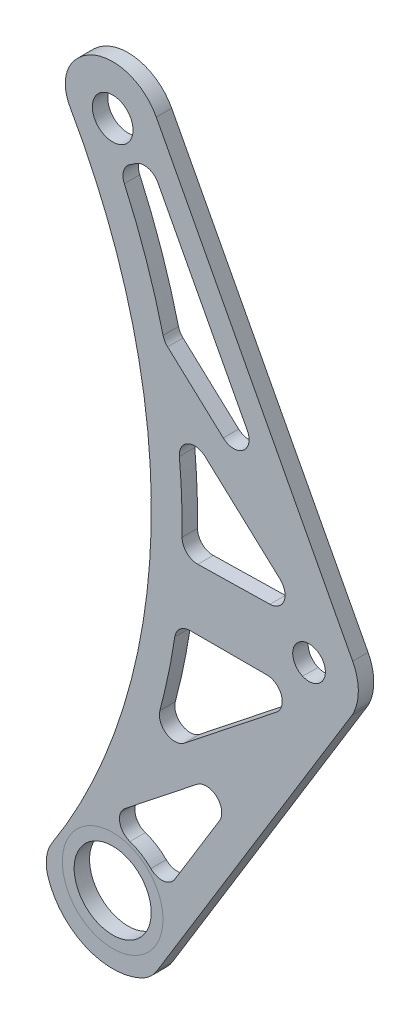
from build123d import *

# Parameters (mm, degrees)
SKETCH1_R           = 7.9375
SKETCH1_R_2         = 3.3655
SKETCH1_R_3         = 4.191
BOSS_EXTRUDE1_DEPTH = 3.175
CUT_EXTRUDE1_DEPTH  = 6.35
FILLET1_R           = 3.175
FILLET5_R           = 7.62


with BuildPart() as part:
    # Sketch1 → Boss-Extrude1 (new body)
    with BuildSketch(Plane.XY):
        with BuildLine():
            Line((8.990505701, 142.507164257), (49.453246099, 65.638340515))
            ThreePointArc((49.453246099, 65.638340515), (50.622740399, 60.905856258), (49.453246099, 56.173372001))
            Line((49.453246099, 56.173372001), (8.177790267, -11.326281223))
            ThreePointArc((8.177790267, -11.326281223), (-6.360706327, -12.437938536), (-13.97, 0))
            ThreePointArc((-13.97, 0), (7.91990549, 68.33468047), (-10.16, 137.77468))
            ThreePointArc((-10.16, 137.77468), (-2.437423033, 147.637974022), (8.990505701, 142.507164257))
        make_face()
        Circle(SKETCH1_R, mode=Mode.SUBTRACT)
        with Locations((40.462740399, 60.905856258)):
            Circle(SKETCH1_R_2, mode=Mode.SUBTRACT)
        with Locations((0, 137.77468)):
            Circle(SKETCH1_R_3, mode=Mode.SUBTRACT)
    extrude(amount=BOSS_EXTRUDE1_DEPTH)

    # Sketch2 → Cut-Extrude1 (cut)
    with BuildSketch(Plane.XY.offset(3.175)):
        with BuildLine():
            ThreePointArc((-0.124257687, 11.111805266), (6.119551738, 9.275707131), (10.264347662, 4.258030452))
            Line((10.264347662, 4.258030452), (31.313727824, 38.681050934))
            Line((31.313727824, 38.681050934), (1.961287607, 15.442397513))
            ThreePointArc((1.961287607, 15.442397513), (0.937773258, 13.267826895), (-0.124257687, 11.111805266))
        make_face()
        with BuildLine():
            Line((6.763206822, 27.343322009), (40.914079215, 54.38094756))
            ThreePointArc((40.914079215, 54.38094756), (40.688544415, 54.369255246), (40.462740399, 54.365356258))
            Line((40.462740399, 54.365356258), (13.177274796, 54.365356258))
            ThreePointArc((13.177274796, 54.365356258), (10.666365072, 40.689104041), (6.763206822, 27.343322009))
        make_face()
        with BuildLine():
            Line((14.227692925, 66.924652484), (40.332379532, 67.445056996))
            Line((40.332379532, 67.445056996), (12.691282428, 92.804736539))
            ThreePointArc((12.691282428, 92.804736539), (14.081637817, 79.901629399), (14.227692925, 66.924652484))
        make_face()
        with BuildLine():
            Line((10.611239694, 103.330724773), (36.257061309, 79.801636355))
            Line((36.257061309, 79.801636355), (6.979807085, 135.420906636))
            ThreePointArc((6.979807085, 135.420906636), (4.67858985, 132.085325641), (0.961351613, 130.471683418))
            ThreePointArc((0.961351613, 130.471683418), (6.511625183, 117.159092878), (10.611239694, 103.330724773))
        make_face()
    extrude(amount=-CUT_EXTRUDE1_DEPTH, mode=Mode.SUBTRACT)

    # Fillet1
    # the kernel refuses this fillet: 3.175 mm, written as the material it adds along each edge
    with BuildSketch(Plane(origin=(1.961287607, 15.442397513, 3.175), x_dir=(-0.42030668038784, -0.9073821104812206, 0), z_dir=(0, 0, -1))) as fillet1_piece_1:
        with BuildLine():
            CenterArc((0.755742265, -3.174987871), FILLET1_R, 90.158373023, 26.618624782)
            Line((-0.674656078, -0.340453415), (0, 0))
            ThreePointArc((0, 0), (0.373483081, -0.000516178), (0.746966162, 0))
        make_face()
    extrude(amount=3.175)
    with BuildSketch(Plane(origin=(-0.124257687, 11.111805266, 3.175), x_dir=(0.4359761911813302, 0.8999581994309626, 0), z_dir=(0, 0, -1))) as fillet1_piece_2:
        with BuildLine():
            CenterArc((4.22998716, 3.174619998), FILLET1_R, 172.83641486, 96.277116616)
            ThreePointArc((1.07977071, 3.570550945), (0.690776023, 1.739644609), (0, 0))
            ThreePointArc((0, 0), (2.090433086, 0.016171698), (4.180866173, 0))
        make_face()
    extrude(amount=3.175)
    with BuildSketch(Plane(origin=(10.264347662, 4.258030452, 3.175), x_dir=(0.5216861951219568, 0.853137453063207, 0), z_dir=(0, 0, -1))) as fillet1_piece_3:
        with BuildLine():
            CenterArc((4.899209013, -3.175), FILLET1_R, 90, 103.603922827)
            ThreePointArc((1.813283958, -3.921787493), (1.099083544, -1.871916155), (0, 0))
            Line((0, 0), (4.899209013, 0))
        make_face()
    extrude(amount=3.175)
    with BuildSketch(Plane(origin=(31.313727824, 38.681050934, 3.175), x_dir=(-0.7840288614357019, -0.6207243707442435, 0), z_dir=(0, 0, -1))) as fillet1_piece_4:
        with BuildLine():
            CenterArc((FILLET1_R * 5.61807899766, -FILLET1_R), FILLET1_R, 90, 159.814477423)
            Line((FILLET1_R * 5.27301794688, -FILLET1_R * 1.9385802423), (0, 0))
            Line((0, 0), (FILLET1_R * 5.61807899766, 0))
        make_face()
    extrude(amount=3.175)
    with BuildSketch(Plane(origin=(40.914079215, 54.38094756, 3.175), x_dir=(-0.9999985466583668, -0.0017048991624346568, 0), z_dir=(0, 0, -1))) as fillet1_piece_5:
        with BuildLine():
            CenterArc((9.150412322, -3.174995386), FILLET1_R, 90.097683574, 141.630948821)
            Line((7.1838593, -5.667643418), (6.987203998, -5.916908221))
            Line((6.987203998, -5.916908221), (-0.196655302, -0.249264803))
            Line((-0.196655302, -0.249264803), (0.021369604, 0.316780034))
            ThreePointArc((0.021369604, 0.316780034), (0.450823437, 0.302677747), (9.144457961, 0.317499539))
            Line((9.144457961, 0.317499539), (9.144999267, 0))
        make_face()
    extrude(amount=3.175)
    with BuildSketch(Plane(origin=(6.763206822, 27.343322009, 3.175), x_dir=(0.29421486221715376, 0.9557393027654252, 0), z_dir=(0, 0, -1))) as fillet1_piece_6:
        with BuildLine():
            CenterArc((10.215496918, 3.172783065), FILLET1_R, 124.520485767, 143.338263429)
            Line((8.41622168, 5.788740561), (0, 0))
            ThreePointArc((0, 0), (5.048434414, 0.094345715), (10.096868828, 0))
        make_face()
    extrude(amount=3.175)
    with BuildSketch(Plane(origin=(13.177274796, 54.365356258, 3.175), x_dir=(-0.1397274976091422, -0.9901899951079526, 0), z_dir=(0, 0, -1))) as fillet1_piece_7:
        with BuildLine():
            CenterArc((2.758448164, -3.174838407), FILLET1_R, 90.57806828, 81.3898537)
            Line((-0.38540507, -2.731203602), (0, 0))
            ThreePointArc((0, 0), (1.363207757, -0.006876893), (2.726415514, 0))
        make_face()
    extrude(amount=3.175)
    with BuildSketch(Plane(origin=(12.691282428, 92.804736539, 3.175), x_dir=(0.12348134501551586, -0.992346893698549, 0), z_dir=(0, 0, -1))) as fillet1_piece_8:
        with BuildLine():
            CenterArc((8.634113181, -3.173416471), FILLET1_R, 91.809659599, 137.818629886)
            Line((6.577526563, -5.59231632), (0, 0))
            ThreePointArc((0, 0), (4.266924504, -0.06738998), (8.533849008, 0))
        make_face()
    extrude(amount=3.175)
    with BuildSketch(Plane(origin=(14.227692925, 66.924652484, 3.175), x_dir=(0.024643115282951916, 0.9996963123214726, 0), z_dir=(0, 0, -1))) as fillet1_piece_9:
        with BuildLine():
            CenterArc((3.319776694, 3.174765946), FILLET1_R, 177.445853815, 91.858439002)
            Line((0.147930885, 3.316255051), (0, 0))
            ThreePointArc((0, 0), (1.640612791, 0.009960595), (3.281225581, 0))
        make_face()
    extrude(amount=3.175)
    with BuildSketch(Plane(origin=(40.332379532, 67.445056996, 3.175), x_dir=(-0.7368618420904852, 0.6760433607920552, 0), z_dir=(0, 0, -1))) as fillet1_piece_10:
        with BuildLine():
            CenterArc((FILLET1_R * 2.49529647453, -FILLET1_R), FILLET1_R, 90, 136.322717601)
            Line((FILLET1_R * 1.80470077201, -FILLET1_R * 1.72324102183), (0, 0))
            Line((0, 0), (FILLET1_R * 2.49529647453, 0))
        make_face()
    extrude(amount=3.175)
    with BuildSketch(Plane(origin=(36.257061309, 79.801636355, 3.175), x_dir=(-0.736861842090485, 0.6760433607920552, 0), z_dir=(0, 0, -1))) as fillet1_piece_11:
        with BuildLine():
            CenterArc((FILLET1_R * 5.75850458875, FILLET1_R), FILLET1_R, 109.70304414, 160.29695586)
            Line((FILLET1_R * 5.42135931021, FILLET1_R * 1.94145263352), (0, 0))
            Line((0, 0), (FILLET1_R * 5.75850458875, 0))
        make_face()
    extrude(amount=3.175)
    with BuildSketch(Plane(origin=(10.611239694, 103.330724773, 3.175), x_dir=(0.7368618420904525, -0.6760433607920909, 0), z_dir=(0, 0, -1))) as fillet1_piece_12:
        with BuildLine():
            CenterArc((0.964871334, -3.175), FILLET1_R, 90, 33.606646982)
            ThreePointArc((-0.792453619, -0.530678913), (-0.395758583, -0.266038651), (0, 0))
            Line((0, 0), (0.964871334, 0))
        make_face()
    extrude(amount=3.175)
    with BuildSketch(Plane(origin=(0.961351613, 130.471683418, 3.175), x_dir=(0.42205519537851754, -0.9065701363126856, 0), z_dir=(0, 0, -1))) as fillet1_piece_13:
        with BuildLine():
            CenterArc((3.47040448, -3.174744224), FILLET1_R, 90.727275071, 84.025505032)
            ThreePointArc((0.308709742, -2.884379996), (0.297748154, -1.426842886), (0, 0))
            ThreePointArc((0, 0), (1.715052097, -0.01088502), (3.430104193, 0))
        make_face()
    extrude(amount=3.175)
    with BuildSketch(Plane(origin=(6.979807085, 135.420906636, 3.175), x_dir=(-0.5768732919878915, -0.8168336458490512, 0), z_dir=(0, 0, -1))) as fillet1_piece_14:
        with BuildLine():
            CenterArc((5.114466288, -3.042745801), FILLET1_R, 106.595474978, 100.411869016)
            Line((2.285705354, -4.484528231), (0, 0))
            ThreePointArc((0, 0), (2.103823012, -0.306829742), (4.207646024, 0))
        make_face()
    extrude(amount=3.175)

    # Fillet5
    # the kernel refuses this fillet: 7.62 mm, written as the material it takes off along each edge
    with BuildSketch(Plane(origin=(49.453246099, 56.173372001, -1.634441158), x_dir=(0.4370839848417488, 0.8994206970016078, 0), z_dir=(0, 0, 1))) as fillet5_piece_1:
        with BuildLine():
            CenterArc((0.40861029, 7.616054986), FILLET5_R, 264.472549142, 7.371205669)
            Line((-0.325368255, 0.031486739), (0, 0))
            ThreePointArc((0, 0), (0.326888232, -0.005260019), (0.653776463, 0))
        make_face()
    extrude(amount=6.443882317, mode=Mode.SUBTRACT)
    with BuildSketch(Plane(origin=(8.177790267, -11.326281223, -6.850611907), x_dir=(-0.8642606797046686, -0.5030442103000734, 0), z_dir=(0, 0, 1))) as fillet5_piece_2:
        with BuildLine():
            CenterArc((1.992905282, -7.583263394), FILLET5_R, 84.371608536, 33.981356684)
            Line((-1.625847463, -0.877368333), (0, 0))
            ThreePointArc((0, 0), (1.370122381, 0.067350445), (2.740244763, 0))
        make_face()
    extrude(amount=16.876223814, mode=Mode.SUBTRACT)
    with BuildSketch(Plane(origin=(-13.97, 0, -10.334031649), x_dir=(0.5495701737634485, 0.8354475591619218, 0), z_dir=(0, 0, 1))) as fillet5_piece_3:
        with BuildLine():
            CenterArc((2.78803259, -7.619578759), FILLET5_R, 90.602458764, 49.750903142)
            ThreePointArc((-3.079322695, -2.757630389), (-1.64222079, -1.264291645), (0, 0))
            ThreePointArc((0, 0), (1.353955306, -0.00711841), (2.707910612, 0))
        make_face()
    extrude(amount=23.843063299, mode=Mode.SUBTRACT)
    with BuildSketch(Plane(origin=(-10.16, 137.77468, -14.229821855), x_dir=(0.28011460344612044, 0.9599665665720981, 0), z_dir=(0, 0, 1))) as fillet5_piece_4:
        with BuildLine():
            CenterArc((3.557455464, -7.314945237), FILLET5_R, 73.732955283, 62.075524842)
            ThreePointArc((-1.906189574, -2.003355748), (-0.947716818, -1.006795003), (0, 0))
            ThreePointArc((0, 0), (2.845964371, 0.406739684), (5.691928742, 0))
        make_face()
    extrude(amount=31.63464371, mode=Mode.SUBTRACT)


solid = part.part
